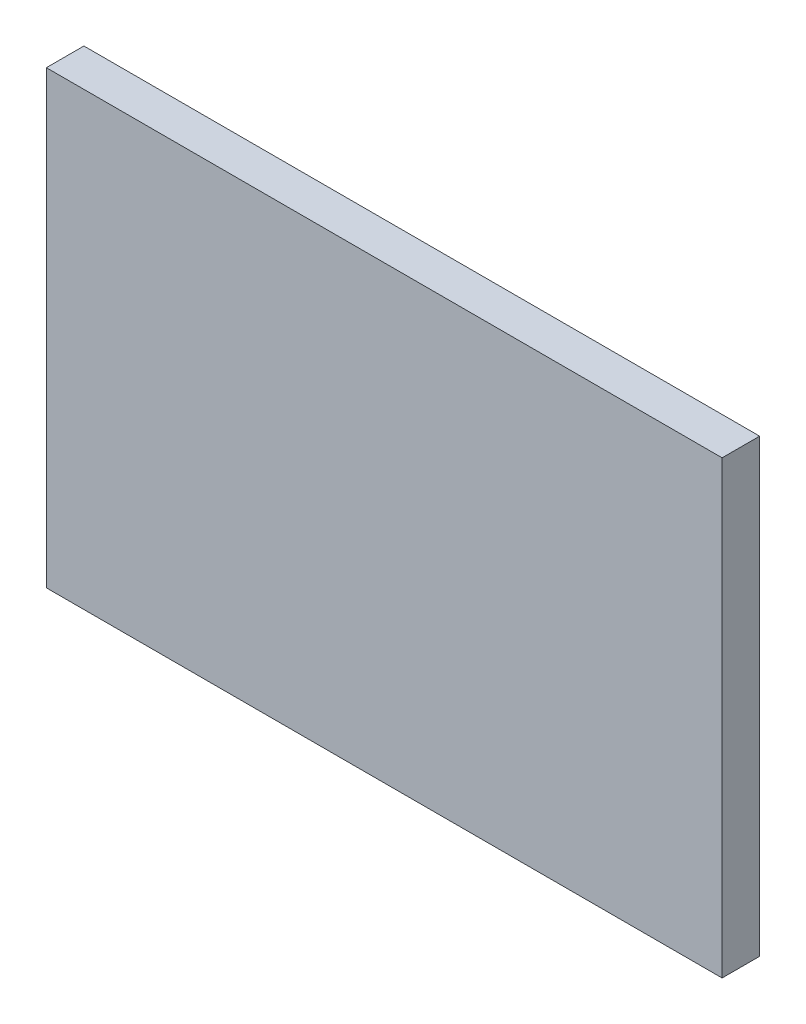
from build123d import *

# Parameters (mm, degrees)
CROQUIS1_W              = 90
CROQUIS1_H              = 60
SALIENTE_EXTRUIR1_DEPTH = 5


with BuildPart() as part:
    # Croquis1 → Saliente-Extruir1 (new body)
    with BuildSketch(Plane.XY):
        Rectangle(CROQUIS1_W, CROQUIS1_H)
    extrude(amount=SALIENTE_EXTRUIR1_DEPTH)


solid = part.part
